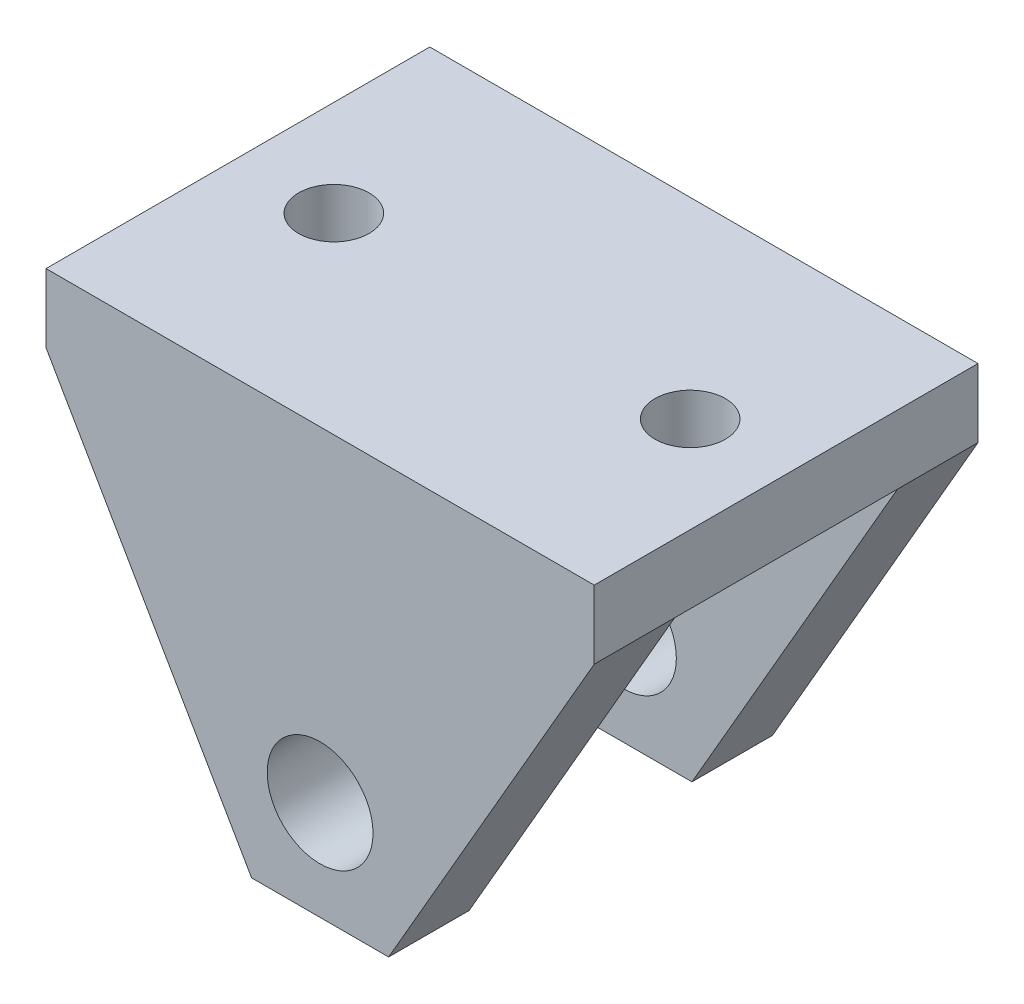
from build123d import *

# Parameters (mm, degrees)
SKETCH2_W           = 50.8
SKETCH2_H           = 35.56
SKETCH2_R           = 3.2639
BOSS_EXTRUDE1_DEPTH = 39.37
SKETCH4_R           = 4.9022
CUT_EXTRUDE1_DEPTH  = 59.818963779
SKETCH5_W           = 50.8
SKETCH5_H           = 20.6502
CUT_EXTRUDE2_DEPTH  = 33.02


with BuildPart() as part:
    # Sketch2 → Boss-Extrude1 (new body)
    with BuildSketch(Plane(origin=(0, 0, 0), x_dir=(1, 0, 0), z_dir=(0, 1, 0))):
        Rectangle(SKETCH2_W, SKETCH2_H)
        with Locations((-16.51, 0)):
            Circle(SKETCH2_R, mode=Mode.SUBTRACT)
        with Locations((16.51, 0)):
            Circle(SKETCH2_R, mode=Mode.SUBTRACT)
    extrude(amount=-BOSS_EXTRUDE1_DEPTH)

    # Sketch4 → Cut-Extrude1 (cut, through all)
    with BuildSketch(Plane.XY.offset(17.78)):
        with Locations((0, -30.17136968)):
            Circle(SKETCH4_R)
        Polygon((-25.4, -6.35), (-6.35, -39.37), (-25.4, -39.37), align=None)
        Polygon((6.35, -39.37), (25.4, -39.37), (25.4, -6.35), align=None)
    extrude(amount=-CUT_EXTRUDE1_DEPTH, mode=Mode.SUBTRACT)

    # Sketch5 → Cut-Extrude2 (cut)
    with BuildSketch(Plane.XZ.offset(39.37)):
        Rectangle(SKETCH5_W, SKETCH5_H)
    extrude(amount=-CUT_EXTRUDE2_DEPTH, mode=Mode.SUBTRACT)


solid = part.part
